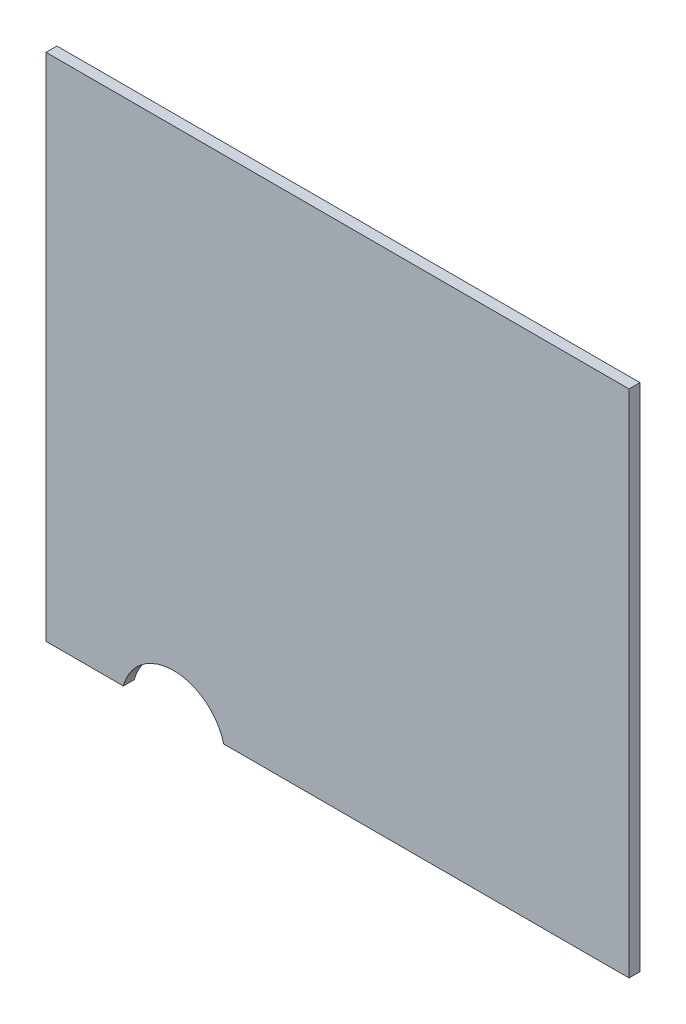
from build123d import *

# Parameters (mm, degrees)
SKETCH1_W           = 160
SKETCH1_H           = 140
BOSS_EXTRUDE1_DEPTH = 3
SKETCH2_R           = 14.275
CUT_EXTRUDE1_DEPTH  = 3


with BuildPart() as part:
    # Sketch1 → Boss-Extrude1 (new body)
    with BuildSketch(Plane.XY):
        with Locations((80, 70)):
            Rectangle(SKETCH1_W, SKETCH1_H)
    extrude(amount=BOSS_EXTRUDE1_DEPTH)

    # Sketch2 → Cut-Extrude1 (cut)
    with BuildSketch(Plane.XY.offset(3)):
        with Locations((35, -3.69)):
            Circle(SKETCH2_R)
    extrude(amount=-CUT_EXTRUDE1_DEPTH, mode=Mode.SUBTRACT)


solid = part.part
